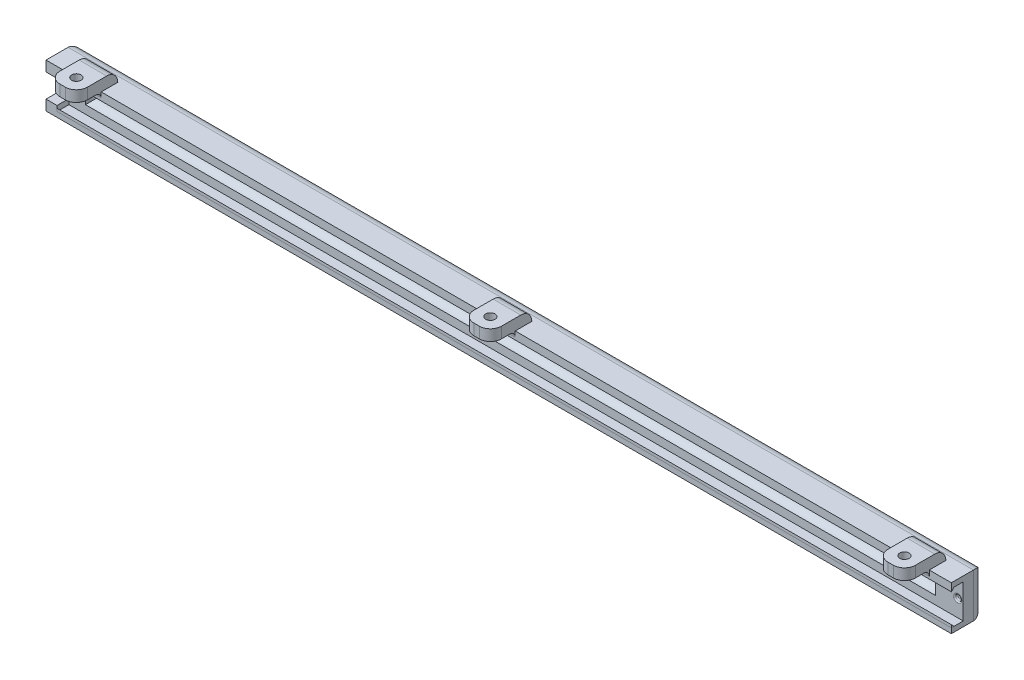
from build123d import *

# Parameters (mm, degrees)
SKETCH1_W               = 328
SKETCH1_H               = 16
BOSS_EXTRUDE1_DEPTH     = 6
CUT_EXTRUDE1_DEPTH      = 332.42615789
CUT_EXTRUDE1_DEPTH_BACK = 324
SKETCH3_W               = 4.3
SKETCH3_H               = 12.3
SKETCH13_W              = 10
SKETCH13_H              = 15
BOSS_EXTRUDE5_DEPTH     = 4
FILLET10_R              = 4
SKETCH14_R              = 1.7
CUT_EXTRUDE5_DEPTH      = 4
FILLET11_R              = 4
FILLET12_R              = 4
FILLET22_R              = 2
SKETCH17_W              = 328
SKETCH17_H              = 16
BOSS_EXTRUDE6_DEPTH     = 6
FILLET25_R              = 4
SKETCH18_R              = 1
CUT_EXTRUDE6_DEPTH      = 0.7
FILLET26_R              = 0.5
FILLET27_R              = 0.5
SKETCH21_W              = 4
SKETCH21_H              = 8.5
CUT_EXTRUDE8_DEPTH      = 333.303344903
BOSS_EXTRUDE7_DEPTH     = 324
BOSS_EXTRUDE8_DEPTH     = 324
SKETCH25_W              = 308
SKETCH25_H              = 6.3
CUT_EXTRUDE9_DEPTH      = 3
FILLET29_R              = 3.15
LPATTERN1_START         = 47.151862464
LPATTERN1_OUTLINE_R     = 1.7
LPATTERN1_DEPTH         = 4
LPATTERN1_START_2       = 2.46991404
LPATTERN1_2_DEPTH       = 10
LPATTERN1_START_3       = 152.46991404
LPATTERN1_3_DEPTH       = 10


with BuildPart() as part:
    # Sketch1 → Boss-Extrude1 (new body)
    with BuildSketch(Plane.XY):
        with Locations((6.46991404, 39.151862464)):
            Rectangle(SKETCH1_W, SKETCH1_H)
    extrude(amount=BOSS_EXTRUDE1_DEPTH)

    # Sketch3 → Cut-Extrude1 (cut, two sides: drawn at the far end of the back side and taken through both)
    with BuildSketch(Plane(origin=(170.46991404, 0, 0), x_dir=(0, 0, -1), z_dir=(1, 0, 0)).offset(-CUT_EXTRUDE1_DEPTH_BACK)):
        with Locations((-3.85, 39.151862464)):
            Rectangle(SKETCH3_W, SKETCH3_H)
    extrude(amount=CUT_EXTRUDE1_DEPTH + CUT_EXTRUDE1_DEPTH_BACK, mode=Mode.SUBTRACT)

    # Sketch13 → Boss-Extrude5 (add)
    with BuildSketch(Plane(origin=(0, 47.151862464, 0), x_dir=(1, 0, 0), z_dir=(0, 1, 0))):
        with Locations((-142.53008596, -7.5)):
            Rectangle(SKETCH13_W, SKETCH13_H)
    extrude(amount=BOSS_EXTRUDE5_DEPTH)

    # Fillet10
    fillet10_edges = [part.edges().sort_by_distance(p)[0] for p in [
        (-142.53008596, 51.151862464, 0),
    ]]
    fillet(fillet10_edges, radius=FILLET10_R)

    # Sketch14 → Cut-Extrude5 (cut)
    with BuildSketch(Plane.XZ.offset(-47.151862464)):
        with Locations(Location((-142.53008596, 10, 0), (0, 0, 270))):
            Circle(SKETCH14_R)
    extrude(amount=-CUT_EXTRUDE5_DEPTH, mode=Mode.SUBTRACT)

    # Fillet11
    fillet11_edges = [part.edges().sort_by_distance(p)[0] for p in [
        (-137.53008596, 49.151862464, 15),
    ]]
    fillet(fillet11_edges, radius=FILLET11_R)

    # Fillet12
    fillet12_edges = [part.edges().sort_by_distance(p)[0] for p in [
        (-147.53008596, 49.151862464, 15),
    ]]
    fillet(fillet12_edges, radius=FILLET12_R)

    # Fillet22
    # the kernel refuses this fillet: 2 mm, written as the material it adds along each edge
    with BuildSketch(Plane(origin=(-147.53008596, 47.151862464, 6), x_dir=(0, 0, 1), z_dir=(1, 0, 0))) as fillet22_piece_1:
        with BuildLine():
            CenterArc((1.994367068, 2), FILLET22_R, 184.301222305, 85.698777695)
            Line((0, 1.85), (0, 0))
            Line((0, 0), (1.994367068, 0))
        make_face()
    extrude(amount=10)

    # Sketch17 → Boss-Extrude6 (add)
    with BuildSketch(Plane(origin=(0, 0, 0), x_dir=(-1, 0, 0), z_dir=(0, 0, -1))):
        with Locations((-6.46991404, 39.151862464)):
            Rectangle(SKETCH17_W, SKETCH17_H)
    extrude(amount=BOSS_EXTRUDE6_DEPTH)

    # Fillet25
    fillet25_edges = [part.edges().sort_by_distance(p)[0] for p in [
        (170.46991404, 39.151862464, -6),
        (6.46991404, 31.151862464, -6),
        (-157.53008596, 39.151862464, -6),
        (6.46991404, 47.151862464, -6),
    ]]
    fillet(fillet25_edges, radius=FILLET25_R)

    # Sketch18 → Cut-Extrude6 (cut)
    with BuildSketch(Plane.XY.offset(1.7)):
        with Locations((168.46991404, 39.151862464)):
            Circle(SKETCH18_R)
    extrude(amount=-CUT_EXTRUDE6_DEPTH, mode=Mode.SUBTRACT)

    # Fillet26
    fillet26_edges = [part.edges().sort_by_distance(p)[0] for p in [
        (167.46991404, 39.151862464, 1.7),
    ]]
    fillet(fillet26_edges, radius=FILLET26_R)

    # Fillet27
    fillet27_edges = [part.edges().sort_by_distance(p)[0] for p in [
        (167.46991404, 39.151862464, 1),
    ]]
    fillet(fillet27_edges, radius=FILLET27_R)

    # Sketch21 → Cut-Extrude8 (cut, through all)
    with BuildSketch(Plane.ZY.offset(157.53008596)):
        with Locations((4, 39.151862464)):
            Rectangle(SKETCH21_W, SKETCH21_H)
    extrude(amount=-CUT_EXTRUDE8_DEPTH, mode=Mode.SUBTRACT)

    # Sketch23 → Boss-Extrude7 (add)
    with BuildSketch(Plane(origin=(170.46991404, 0, 0), x_dir=(0, 0, -1), z_dir=(1, 0, 0))):
        Polygon((-6, 45.301862464), (-6, 44.301862464), (-5, 45.301862464), align=None)
    extrude(amount=-BOSS_EXTRUDE7_DEPTH)

    # Sketch25 → Cut-Extrude9 (cut)
    with BuildSketch(Plane.XY.offset(1.7)):
        with Locations((6.46991404, 39.151862464)):
            Rectangle(SKETCH25_W, SKETCH25_H)
    extrude(amount=-CUT_EXTRUDE9_DEPTH, mode=Mode.SUBTRACT)

    # Fillet29
    # the kernel refuses this fillet: 3.15 mm, written as the material it adds along each edge
    with BuildSketch(Plane(origin=(-155.396152321, 42.301862464, -1.3), x_dir=(0, 0, 1), z_dir=(1, 0, 0)), Plane(origin=(168.335980401, 36.001862464, -1.3), x_dir=(0, 0, 1), z_dir=(-1, 0, 0))) as fillet29_piece_1:
        with BuildLine():
            CenterArc((3.15, 3.146426545), FILLET29_R, 180, 87.270597363)
            Line((0, 3.146426545), (0, 0))
            Line((0, 0), (3, 0))
        make_face()
    extrude(amount=323.732132723)
    with BuildSketch(Plane(origin=(160.46991404, 50.167928825, -1.3), x_dir=(0, 0, 1), z_dir=(0, -1, 0))) as fillet29_piece_2_section:
        with BuildLine():
            CenterArc((3.15, 3.146426545), FILLET29_R, 180, 87.270597363)
            Line((0, 3.146426545), (0, 0))
            Line((0, 0), (3, 0))
        make_face()
    fillet29_piece_2 = extrude(amount=22.032132723, mode=Mode.PRIVATE)
    fillet29_piece_2 = split(fillet29_piece_2, bisect_by=Plane(origin=(160.46991404, 31.151862464, -1.3), z_dir=(0, 1, 0)), keep=Keep.TOP, mode=Mode.PRIVATE)
    fillet29_piece_2 = split(fillet29_piece_2, bisect_by=Plane(origin=(160.46991404, 47.151862464, -1.3), z_dir=(0, -1, 0)), keep=Keep.TOP, mode=Mode.PRIVATE)
    add(fillet29_piece_2)
    with BuildSketch(Plane(origin=(-147.53008596, 28.135796103, -1.3), x_dir=(0, 0, 1), z_dir=(0, 1, 0))) as fillet29_piece_3_section:
        with BuildLine():
            CenterArc((3.15, 3.146426545), FILLET29_R, 180, 87.270597363)
            Line((0, 3.146426545), (0, 0))
            Line((0, 0), (3, 0))
        make_face()
    fillet29_piece_3 = extrude(amount=22.032132723, mode=Mode.PRIVATE)
    fillet29_piece_3 = split(fillet29_piece_3, bisect_by=Plane(origin=(-147.53008596, 31.151862464, -1.3), z_dir=(0, 1, 0)), keep=Keep.TOP, mode=Mode.PRIVATE)
    fillet29_piece_3 = split(fillet29_piece_3, bisect_by=Plane(origin=(-147.53008596, 47.151862464, -1.3), z_dir=(0, -1, 0)), keep=Keep.TOP, mode=Mode.PRIVATE)
    add(fillet29_piece_3)

    # LPattern1: read off the stored shape, not the designer's step
    # LPattern1 outline → LPattern1 (add)
    # profile 1 of 2: a face of its own
    with BuildSketch(Plane(origin=(0, 0, 0), x_dir=(1, 0, 0), z_dir=(0, 1, 0)).offset(LPATTERN1_START)):
        with BuildLine():
            Line((12.46991404, -11), (12.46991404, -6))
            Line((12.46991404, -6), (2.46991404, -6))
            Line((2.46991404, -6), (2.46991404, -11))
            ThreePointArc((2.46991404, -11), (3.641486915, -13.828427125), (6.46991404, -15))
            Line((6.46991404, -15), (8.46991404, -15))
            ThreePointArc((8.46991404, -15), (11.298341165, -13.828427125), (12.46991404, -11))
        make_face()
        with Locations((7.46991404, -10)):
            Circle(LPATTERN1_OUTLINE_R, mode=Mode.SUBTRACT)
    # profile 2 of 2: a face of its own
    with BuildSketch(Plane(origin=(0, 0, 0), x_dir=(1, 0, 0), z_dir=(0, 1, 0)).offset(LPATTERN1_START)):
        with BuildLine():
            Line((156.46991404, -15), (158.46991404, -15))
            ThreePointArc((158.46991404, -15), (161.298341165, -13.828427125), (162.46991404, -11))
            Line((162.46991404, -11), (162.46991404, -6))
            Line((162.46991404, -6), (152.46991404, -6))
            Line((152.46991404, -6), (152.46991404, -11))
            ThreePointArc((152.46991404, -11), (153.641486915, -13.828427125), (156.46991404, -15))
        make_face()
        with Locations((157.46991404, -10)):
            Circle(LPATTERN1_OUTLINE_R, mode=Mode.SUBTRACT)
    extrude(amount=LPATTERN1_DEPTH)

    # LPattern1 2 outline → LPattern1 2 (add)
    with BuildSketch(Plane.YZ.offset(LPATTERN1_START_2)):
        with BuildLine():
            Line((45.151862464, 6), (47.151862464, 6))
            Line((47.151862464, 6), (47.151862464, 8))
            ThreePointArc((47.151862464, 8), (46.566076026, 6.585786437), (45.151862464, 6))
        make_face()
        with BuildLine():
            Line((51.151862464, 4), (51.151862464, 6))
            Line((51.151862464, 6), (47.151862464, 6))
            Line((47.151862464, 6), (47.151862464, 0))
            ThreePointArc((47.151862464, 0), (49.980289589, 1.171572875), (51.151862464, 4))
        make_face()
    extrude(amount=LPATTERN1_2_DEPTH)

    # LPattern1 3 outline → LPattern1 3 (add)
    with BuildSketch(Plane.YZ.offset(LPATTERN1_START_3)):
        with BuildLine():
            Line((45.151862464, 6), (47.151862464, 6))
            Line((47.151862464, 6), (47.151862464, 8))
            ThreePointArc((47.151862464, 8), (46.566076026, 6.585786437), (45.151862464, 6))
        make_face()
        with BuildLine():
            Line((51.151862464, 4), (51.151862464, 6))
            Line((51.151862464, 6), (47.151862464, 6))
            Line((47.151862464, 6), (47.151862464, 0))
            ThreePointArc((47.151862464, 0), (49.980289589, 1.171572875), (51.151862464, 4))
        make_face()
    extrude(amount=LPATTERN1_3_DEPTH)


with BuildPart() as body_2:
    # Sketch24 → Boss-Extrude8 (new body)
    with BuildSketch(Plane(origin=(170.46991404, 0, 0), x_dir=(0, 0, -1), z_dir=(1, 0, 0))):
        Polygon((-6, 33.001862464), (-6, 34.001862464), (-5, 33.001862464), align=None)
    extrude(amount=-BOSS_EXTRUDE8_DEPTH)


solid = Compound([part.part, body_2.part])
